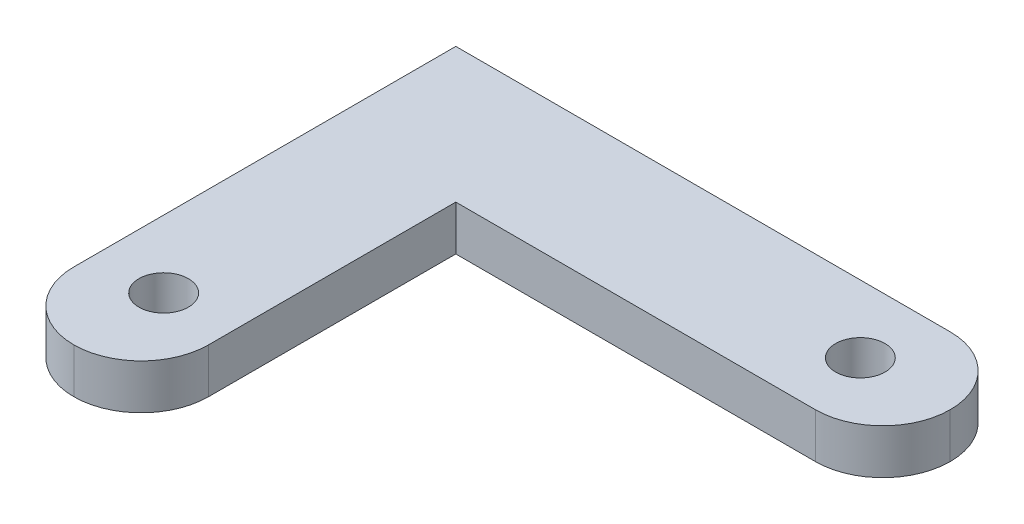
from build123d import *

# Parameters (mm, degrees)
BOSS_EXTRUDE1_DEPTH = 2
SKETCH2_R           = 1.1
CUT_EXTRUDE1_DEPTH  = 2
FILLET1_R           = 3


with BuildPart() as part:
    # Sketch1 → Boss-Extrude1 (new body)
    with BuildSketch(Plane(origin=(0, 0, 0), x_dir=(1, 0, 0), z_dir=(0, 1, 0))):
        Polygon((-6, 6), (-6, -14), (0, -14), (0, 0), (19, 0), (19, 6), align=None)
    extrude(amount=BOSS_EXTRUDE1_DEPTH)

    # Sketch2 → Cut-Extrude1 (cut)
    with BuildSketch(Plane(origin=(0, 2, 0), x_dir=(1, 0, 0), z_dir=(0, 1, 0))):
        with Locations(Location((-3, -10, 0), (0, 0, 270))):
            Circle(SKETCH2_R)
        with Locations(Location((15, 3, 0), (0, 0, 270))):
            Circle(SKETCH2_R)
    extrude(amount=-CUT_EXTRUDE1_DEPTH, mode=Mode.SUBTRACT)

    # Fillet1
    fillet1_edges = [part.edges().sort_by_distance(p)[0] for p in [
        (19, 1, -6),
        (19, 1, 0),
        (-6, 1, 14),
        (0, 1, 14),
    ]]
    fillet(fillet1_edges, radius=FILLET1_R - 0.0001)  # a hair under: the kernel refuses the full size


solid = part.part
